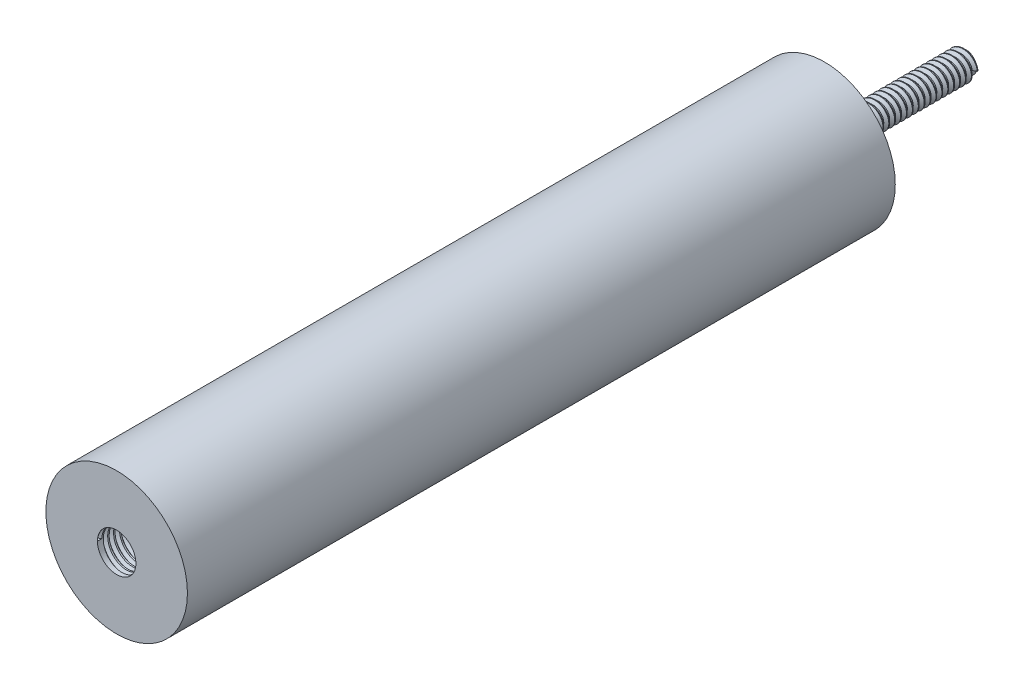
from build123d import *

# Parameters (mm, degrees)
SKETCH1_W           = 25.4
SKETCH1_H           = 32.766
BOSS_EXTRUDE1_DEPTH = 127
SKETCH2_W           = 25.4
SKETCH2_H           = 32.766
SKETCH2_R           = 2.45745
CUT_EXTRUDE2_DEPTH  = 25.4
CUT_EXTRUDE3_DEPTH  = 101.6
SKETCH7_R           = 1.89865
BOSS_EXTRUDE2_DEPTH = 25.4
THREAD3_PITCH       = 1.058333333
BOSS_EXTRUDE3_START = 25.4
SKETCH10_R          = 12.7
BOSS_EXTRUDE3_DEPTH = 25.4
SKETCH11_R          = 3.4544
CUT_EXTRUDE4_DEPTH  = 12.7
THREAD4_PITCH       = 1.058333333


with BuildPart() as part:
    # Sketch1 → Boss-Extrude1 (new body)
    with BuildSketch(Plane.XY):
        with Locations((12.7, 16.383)):
            Rectangle(SKETCH1_W, SKETCH1_H)
    extrude(amount=-BOSS_EXTRUDE1_DEPTH)

    # Sketch2 → Cut-Extrude2 (cut)
    with BuildSketch(Plane.XY):
        with Locations((12.7, 16.383)):
            Rectangle(SKETCH2_W, SKETCH2_H)
        with Locations((12.7, 16.383)):
            Circle(SKETCH2_R, mode=Mode.SUBTRACT)
    extrude(amount=-CUT_EXTRUDE2_DEPTH, mode=Mode.SUBTRACT)

    # Sketch5 → Cut-Extrude3 (cut)
    with BuildSketch(Plane.XY.offset(-25.4)):
        with BuildLine():
            Line((25.4, 32.766), (0, 32.766))
            Line((0, 32.766), (0, 16.383))
            ThreePointArc((0, 16.383), (12.7, 29.083), (25.4, 16.383))
            Line((25.4, 16.383), (25.4, 32.766))
        make_face()
        with BuildLine():
            ThreePointArc((25.4, 16.383), (12.7, 3.683), (0, 16.383))
            Line((0, 16.383), (0, 0))
            Line((0, 0), (25.4, 0))
            Line((25.4, 0), (25.4, 16.383))
        make_face()
    extrude(amount=-CUT_EXTRUDE3_DEPTH, mode=Mode.SUBTRACT)

    # Sketch7 → Boss-Extrude2 (add)
    with BuildSketch(Plane(origin=(0, 0, -127), x_dir=(-1, 0, 0), z_dir=(0, 0, -1))):
        with Locations((-12.7, 16.383)):
            Circle(SKETCH7_R)
    extrude(amount=BOSS_EXTRUDE2_DEPTH)

    # Thread3: arcs per turn and ends read off the stored shape
    # Thread3: the profile of Thread Profile3 profile screwed along a right-hand helix through 24 turns, 8 arcs to a turn; built about Z, then put on its axis
    thread3_z = Axis((0, 0, 0), (0, 0, 1))
    thread3_corners = [(1.89835, 0, -0.000173205), (2.471489718, 0, 0.330729165), (2.471489718, 0, 0.463020832), (1.89835, 0, 0.793923202)]
    with BuildLine(mode=Mode.PRIVATE) as thread3_profile:
        Line(thread3_corners[0], thread3_corners[1])
        Line(thread3_corners[1], thread3_corners[2])
        Line(thread3_corners[2], thread3_corners[3])
        Line(thread3_corners[3], thread3_corners[0])
    thread3_cap = Face(thread3_profile.wire())
    thread3_turn_angles = [0, 22.5, 45, 67.5, 90, 112.5, 135, 157.5, 180, 202.5, 225, 247.5, 270, 292.5, 315, 337.5, 360]
    thread3_turn_weights = [1, 0.9238795325112867, 1, 0.9238795325112867, 1, 0.9238795325112867, 1, 0.9238795325112867, 1, 0.9238795325112867, 1, 0.9238795325112867, 1, 0.9238795325112867, 1, 0.9238795325112867, 1]
    thread3_turn_rails = [Edge.make_bspline([Vector(p[0], p[1], 0).rotate(thread3_z, thread3_turn_angles[k]) / thread3_turn_weights[k] + Vector(0, 0, p[2] + THREAD3_PITCH * thread3_turn_angles[k] / 360) for k in range(17)], [0, 0, 0, 1, 1, 2, 2, 3, 3, 4, 4, 5, 5, 6, 6, 7, 7, 8, 8, 8], 2, thread3_turn_weights) for p in thread3_corners]
    thread3_turn_sides = [Face.make_surface_from_curves(thread3_turn_rails[p[0]], thread3_turn_rails[p[1]]) for p in [(0, 1), (1, 2), (2, 3), (3, 0)]]
    thread3 = Plane(origin=(12.7, 16.383, -152.4), x_dir=(1, 0, 0), z_dir=(0, 0, 1)) * Solid(Shell([*[p.moved(Location((0, 0, THREAD3_PITCH * i))) for i in range(24) for p in thread3_turn_sides], thread3_cap, thread3_cap.rotate(thread3_z, 8640).moved(Location((0, 0, THREAD3_PITCH * 8640 / 360)))]))
    add(thread3)

    # Sketch10 → Boss-Extrude3 (add)
    with BuildSketch(Plane.XY.offset(-25.4).offset(BOSS_EXTRUDE3_START)):
        with Locations((12.7, 16.383)):
            Circle(SKETCH10_R)
    extrude(amount=-BOSS_EXTRUDE3_DEPTH)

    # Sketch11 → Cut-Extrude4 (cut)
    with BuildSketch(Plane.XY):
        with Locations((12.7, 16.383)):
            Circle(SKETCH11_R)
    extrude(amount=-CUT_EXTRUDE4_DEPTH, mode=Mode.SUBTRACT)

    # Thread4: arcs per turn and ends read off the stored shape
    # Thread4: the profile of Thread Profile4 profile screwed along a right-hand helix through 12 turns, 8 arcs to a turn; built about Z, then put on its axis
    thread4_z = Axis((0, 0, 0), (0, 0, 1))
    thread4_corners = [(3.4541, 0, -0.000173205), (4.027239718, 0, 0.330729165), (4.027239718, 0, 0.463020832), (3.4541, 0, 0.793923202)]
    with BuildLine(mode=Mode.PRIVATE) as thread4_profile:
        Line(thread4_corners[0], thread4_corners[1])
        Line(thread4_corners[1], thread4_corners[2])
        Line(thread4_corners[2], thread4_corners[3])
        Line(thread4_corners[3], thread4_corners[0])
    thread4_cap = Face(thread4_profile.wire())
    thread4_turn_angles = [0, 22.5, 45, 67.5, 90, 112.5, 135, 157.5, 180, 202.5, 225, 247.5, 270, 292.5, 315, 337.5, 360]
    thread4_turn_weights = [1, 0.9238795325112867, 1, 0.9238795325112867, 1, 0.9238795325112867, 1, 0.9238795325112867, 1, 0.9238795325112867, 1, 0.9238795325112867, 1, 0.9238795325112867, 1, 0.9238795325112867, 1]
    thread4_turn_rails = [Edge.make_bspline([Vector(p[0], p[1], 0).rotate(thread4_z, thread4_turn_angles[k]) / thread4_turn_weights[k] + Vector(0, 0, p[2] + THREAD4_PITCH * thread4_turn_angles[k] / 360) for k in range(17)], [0, 0, 0, 1, 1, 2, 2, 3, 3, 4, 4, 5, 5, 6, 6, 7, 7, 8, 8, 8], 2, thread4_turn_weights) for p in thread4_corners]
    thread4_turn_sides = [Face.make_surface_from_curves(thread4_turn_rails[p[0]], thread4_turn_rails[p[1]]) for p in [(0, 1), (1, 2), (2, 3), (3, 0)]]
    thread4 = Plane(origin=(12.7, 16.383, 0), x_dir=(-1, 0, 0), z_dir=(0, 0, -1)) * Solid(Shell([*[p.moved(Location((0, 0, THREAD4_PITCH * i))) for i in range(12) for p in thread4_turn_sides], thread4_cap, thread4_cap.rotate(thread4_z, 4320).moved(Location((0, 0, THREAD4_PITCH * 4320 / 360)))]))
    add(thread4, mode=Mode.SUBTRACT)


solid = part.part
